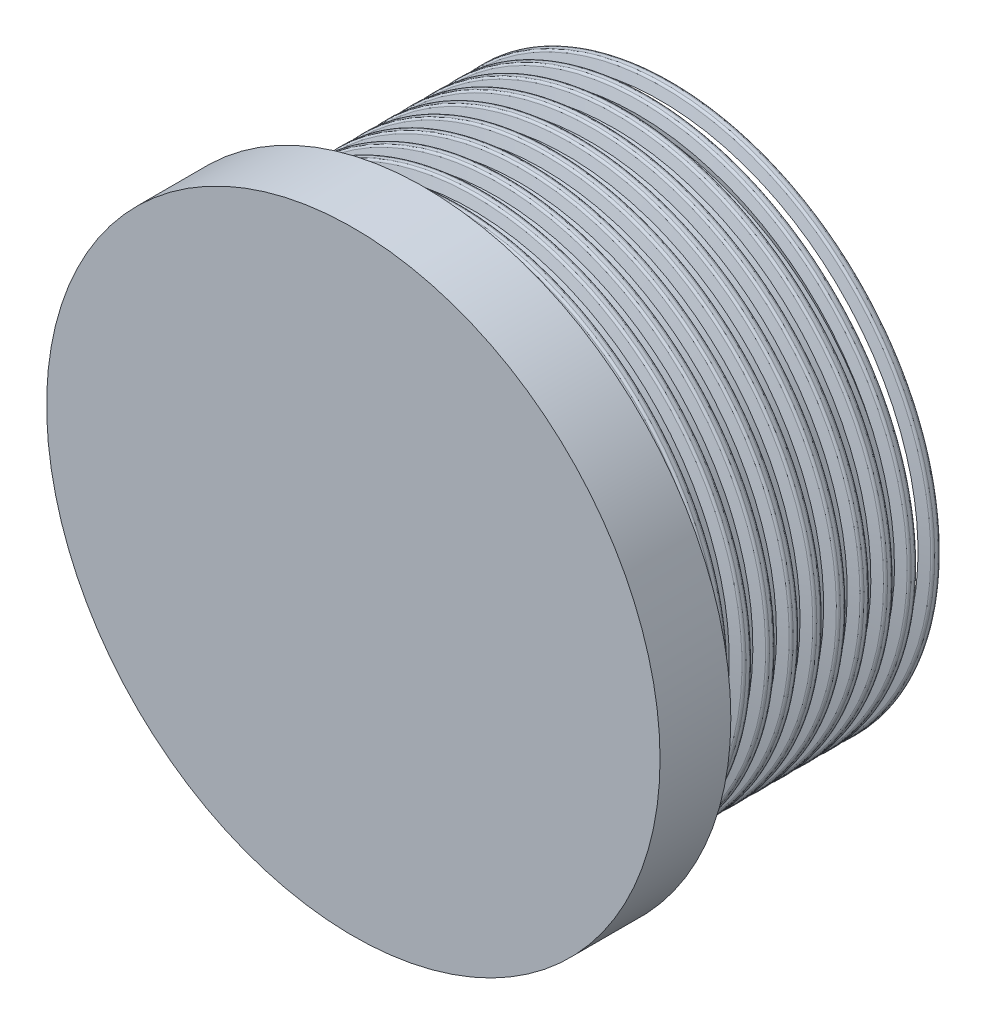
from build123d import *

# Parameters (mm, degrees)
CHANFREIN1_SIZE  = 1
CHANFREIN1_SIZE2 = 0.577350269
BALAYAGE1_PITCH  = 1


with BuildPart() as part:
    # Esquisse1 → Révolution1 (revolve)
    with BuildSketch(Plane(origin=(0, 0, 0), x_dir=(0, 0, -1), z_dir=(1, 0, 0)), mode=Mode.PRIVATE) as r_volution1_sk:
        Polygon((-6.5, 0), (-6.5, 13), (-3.5, 13), (-3.5, 11), (6.5, 11), (6.5, 9), (-3.5, 9), (-3.5, 0), align=None)
    revolve(r_volution1_sk.sketch.rotate(Axis((0, 0, 6.5), (0, 0, -1)), 90), axis=Axis((0, 0, 6.5), (0, 0, -1)))

    # Chanfrein1
    chanfrein1_edges = [part.edges().sort_by_distance(p)[0] for p in [
        (-11, 0, -6.5),
    ]]
    chanfrein1_side = [part.faces().sort_by_distance(p)[0] for p in [
        (-11, 0, -1.5),
    ]]
    chamfer(chanfrein1_edges, length=CHANFREIN1_SIZE, length2=CHANFREIN1_SIZE2, reference=chanfrein1_side[0])

    # Balayage1: the profile of Esquisse5 profile screwed along a left-hand helix of 11.25 turns, 8 arcs to a turn; built about Z, then put on its axis
    balayage1_z = Axis((0, 0, 0), (0, 0, 1))
    balayage1_corners = [(10.9997, 0, -0.284054981), (11.425881905, 0, -0.169859884), (11.5, 0, -0.073267301), (11.5, 0, 0.073267301), (11.425881905, 0, 0.169859884), (10.9997, 0, 0.284054981)]
    with BuildLine(mode=Mode.PRIVATE) as balayage1_profile:
        Line(balayage1_corners[0], balayage1_corners[1])
        Line(balayage1_corners[2], balayage1_corners[3])
        Line(balayage1_corners[4], balayage1_corners[5])
        Line(balayage1_corners[5], balayage1_corners[0])
        ThreePointArc((11.425881905, 0, -0.169859884), (11.479335334, 0, -0.134143444), (11.5, 0, -0.073267301))
        ThreePointArc((11.5, 0, 0.073267301), (11.479335334, 0, 0.134143444), (11.425881905, 0, 0.169859884))
    balayage1_cap = Face(balayage1_profile.wire())
    balayage1_arcs = [((11.425881905, 0, -0.169859884), (11.5, 0, -0.15), (11.5, 0, -0.073267301), (1, 0.7933533402912343, 1)), ((11.5, 0, 0.073267301), (11.5, 0, 0.15), (11.425881905, 0, 0.169859884), (1, 0.7933533402912349, 1))]  # start, shoulder, end, weights
    balayage1_turn_angles = [0, -22.5, -45, -67.5, -90, -112.5, -135, -157.5, -180, -202.5, -225, -247.5, -270, -292.5, -315, -337.5, -360]
    balayage1_turn_weights = [1, 0.9238795325112867, 1, 0.9238795325112867, 1, 0.9238795325112867, 1, 0.9238795325112867, 1, 0.9238795325112867, 1, 0.9238795325112867, 1, 0.9238795325112867, 1, 0.9238795325112867, 1]
    balayage1_turn_rails = [Edge.make_bspline([Vector(p[0], p[1], 0).rotate(balayage1_z, balayage1_turn_angles[k]) / balayage1_turn_weights[k] + Vector(0, 0, p[2] + -BALAYAGE1_PITCH * balayage1_turn_angles[k] / 360) for k in range(17)], [0, 0, 0, 1, 1, 2, 2, 3, 3, 4, 4, 5, 5, 6, 6, 7, 7, 8, 8, 8], 2, balayage1_turn_weights) for p in balayage1_corners]
    balayage1_turn_sides = [*[Face.make_surface_from_curves(balayage1_turn_rails[p[0]], balayage1_turn_rails[p[1]]) for p in [(0, 1), (2, 3), (4, 5), (5, 0)]], *[Face.make_bezier_surface([[Vector(p[j][0], p[j][1], 0).rotate(balayage1_z, balayage1_turn_angles[2 * i + k]) / balayage1_turn_weights[2 * i + k] + Vector(0, 0, p[j][2] + -BALAYAGE1_PITCH * balayage1_turn_angles[2 * i + k] / 360) for k in range(3)] for j in range(3)], [[p[3][j] * balayage1_turn_weights[2 * i + k] for k in range(3)] for j in range(3)]) for p in balayage1_arcs for i in range(8)]]
    balayage1_last_angles = [-3960, -3982.5, -4005, -4027.5, -4050]
    balayage1_last_weights = [1, 0.9238795325112867, 1, 0.9238795325112852, 1]
    balayage1_last_rails = [Edge.make_bspline([Vector(p[0], p[1], 0).rotate(balayage1_z, balayage1_last_angles[k]) / balayage1_last_weights[k] + Vector(0, 0, p[2] + -BALAYAGE1_PITCH * balayage1_last_angles[k] / 360) for k in range(5)], [0, 0, 0, 1, 1, 2, 2, 2], 2, balayage1_last_weights) for p in balayage1_corners]
    balayage1_last_sides = [*[Face.make_surface_from_curves(balayage1_last_rails[p[0]], balayage1_last_rails[p[1]]) for p in [(0, 1), (2, 3), (4, 5), (5, 0)]], *[Face.make_bezier_surface([[Vector(p[j][0], p[j][1], 0).rotate(balayage1_z, balayage1_last_angles[2 * i + k]) / balayage1_last_weights[2 * i + k] + Vector(0, 0, p[j][2] + -BALAYAGE1_PITCH * balayage1_last_angles[2 * i + k] / 360) for k in range(3)] for j in range(3)], [[p[3][j] * balayage1_last_weights[2 * i + k] for k in range(3)] for j in range(3)]) for p in balayage1_arcs for i in range(2)]]
    balayage1 = Plane(origin=(0, 0, 4.033974596), x_dir=(0, 1, 0), z_dir=(0, 0, -1)) * Solid(Shell([*[p.moved(Location((0, 0, BALAYAGE1_PITCH * i))) for i in range(11) for p in balayage1_turn_sides], *balayage1_last_sides, balayage1_cap, balayage1_cap.rotate(balayage1_z, -4050).moved(Location((0, 0, -BALAYAGE1_PITCH * -4050 / 360)))]))
    add(balayage1)


solid = part.part
